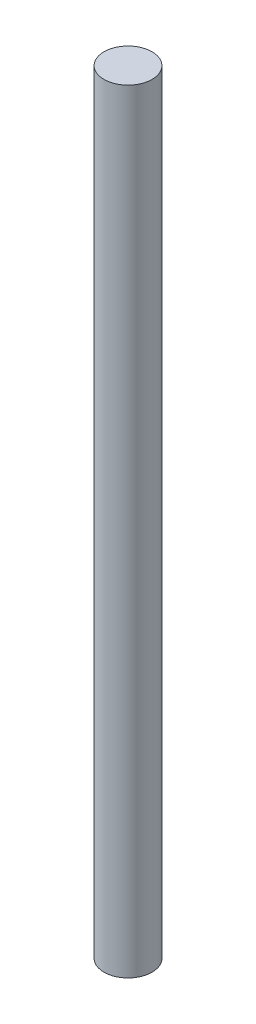
from build123d import *

# Parameters (mm, degrees)
SKETCH2_R           = 1.8
BOSS_EXTRUDE1_DEPTH = 58


with BuildPart() as part:
    # Sketch2 → Boss-Extrude1 (new body)
    with BuildSketch(Plane(origin=(0, 0, 0), x_dir=(1, 0, 0), z_dir=(0, 1, 0))):
        Circle(SKETCH2_R)
    extrude(amount=BOSS_EXTRUDE1_DEPTH)


solid = part.part
